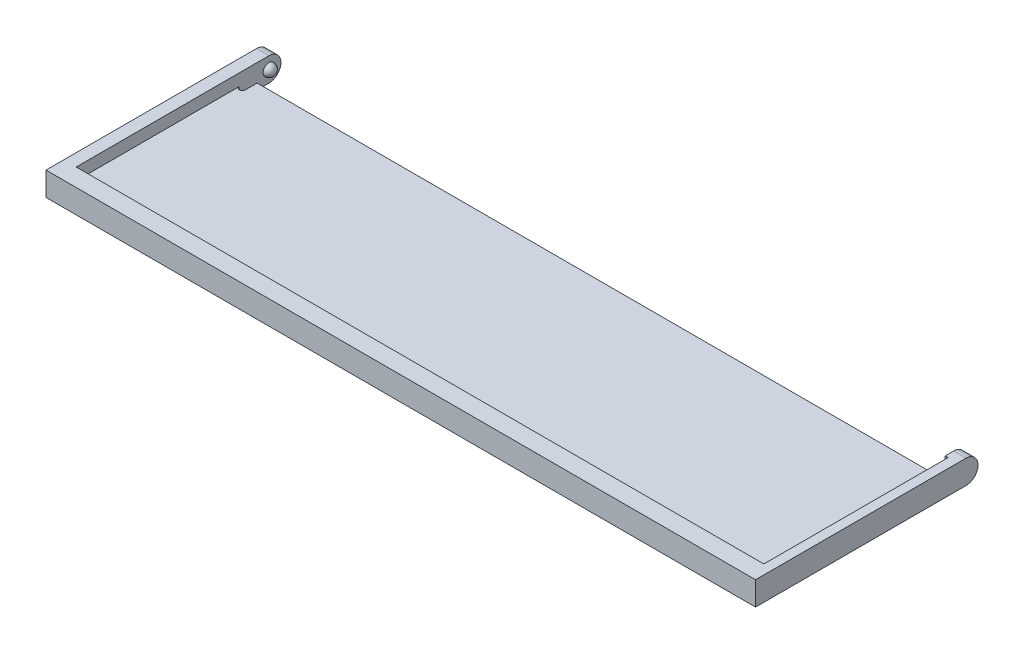
from build123d import *

# Parameters (mm, degrees)
SALIENTE_EXTRUIR1_DEPTH = 4
CROQUIS4_W              = 113.4
CROQUIS4_H              = 2
CORTAR_EXTRUIR1_DEPTH   = 10
REDONDEO1_R             = 2
CROQUIS5_W              = 115.9
CROQUIS5_H              = 31.071267716
CORTAR_EXTRUIR2_DEPTH   = 2


with BuildPart() as part:
    # Croquis1 → Saliente-Extruir1 (new body)
    with BuildSketch(Plane(origin=(0, 0, 0), x_dir=(1, 0, 0), z_dir=(0, 1, 0))):
        Polygon((-65.583943666, 30.054443615), (49.816056334, 30.054443615), (49.816056334, 33.054443615), (51.916056334, 33.054443615), (51.916056334, 30.054443615), (51.916056334, -4.445556385), (-67.683943666, -4.445556385), (-67.683943666, 30.054443615), (-67.683943666, 33.054443615), (-65.583943666, 33.054443615), align=None)
    extrude(amount=SALIENTE_EXTRUIR1_DEPTH)

    # Croquis4 → Cortar-Extruir1 (cut)
    with BuildSketch(Plane(origin=(0, 4, 0), x_dir=(1, 0, 0), z_dir=(0, 1, 0))):
        with Locations((-7.883943666, 29.054443615)):
            Rectangle(CROQUIS4_W, CROQUIS4_H)
        with BuildLine():
            Line((49.816056334, 26.054443615), (49.816056334, 30.054443615))
            Line((49.816056334, 30.054443615), (48.816056334, 30.054443615))
            Line((48.816056334, 30.054443615), (48.816056334, 28.054443615))
            Line((48.816056334, 28.054443615), (48.816056334, 26.054443615))
            ThreePointArc((48.816056334, 26.054443615), (49.316056334, 25.554443615), (49.816056334, 26.054443615))
        make_face()
        with BuildLine():
            Line((-64.583943666, 28.054443615), (-64.583943666, 30.054443615))
            Line((-64.583943666, 30.054443615), (-65.583943666, 30.054443615))
            Line((-65.583943666, 30.054443615), (-65.583943666, 26.054443615))
            ThreePointArc((-65.583943666, 26.054443615), (-65.083943666, 25.554443615), (-64.583943666, 26.054443615))
            Line((-64.583943666, 26.054443615), (-64.583943666, 28.054443615))
        make_face()
    extrude(amount=-CORTAR_EXTRUIR1_DEPTH, mode=Mode.SUBTRACT)

    # Redondeo1
    redondeo1_edges = [part.edges().sort_by_distance(p)[0] for p in [
        (-66.633943666, 0, -33.054443615),
        (-66.633943666, 4, -33.054443615),
        (50.866056334, 0, -33.054443615),
        (50.866056334, 4, -33.054443615),
    ]]
    fillet(redondeo1_edges, radius=REDONDEO1_R - 0.0001)  # a hair under: the kernel refuses the full size

    # Croquis3 → Revolución1 (revolve)
    with BuildSketch(Plane(origin=(-65.583943666, 0, 0), x_dir=(0, 0, -1), z_dir=(1, 0, 0))):
        with BuildLine():
            Line((32.054443615, 2), (30.054443615, 2))
            ThreePointArc((30.054443615, 2), (31.054443615, 1), (32.054443615, 2))
        make_face()
    revolve(axis=Axis((-65.583943666, 2, -32.054443615), (0, 0, 1)))

    # Croquis2 → Revolución2 (revolve)
    with BuildSketch(Plane.ZY.offset(-49.816056334)):
        with BuildLine():
            Line((-32.054443615, 2), (-30.054443615, 2))
            ThreePointArc((-30.054443615, 2), (-31.054443615, 1), (-32.054443615, 2))
        make_face()
    revolve(axis=Axis((49.816056334, 2, -32.054443615), (0, 0, 1)))

    # Croquis5 → Cortar-Extruir2 (cut)
    with BuildSketch(Plane(origin=(0, 4, 0), x_dir=(1, 0, 0), z_dir=(0, 1, 0))):
        with Locations((-7.633943666, 14.090077473)):
            Rectangle(CROQUIS5_W, CROQUIS5_H)
    extrude(amount=-CORTAR_EXTRUIR2_DEPTH, mode=Mode.SUBTRACT)


solid = part.part
